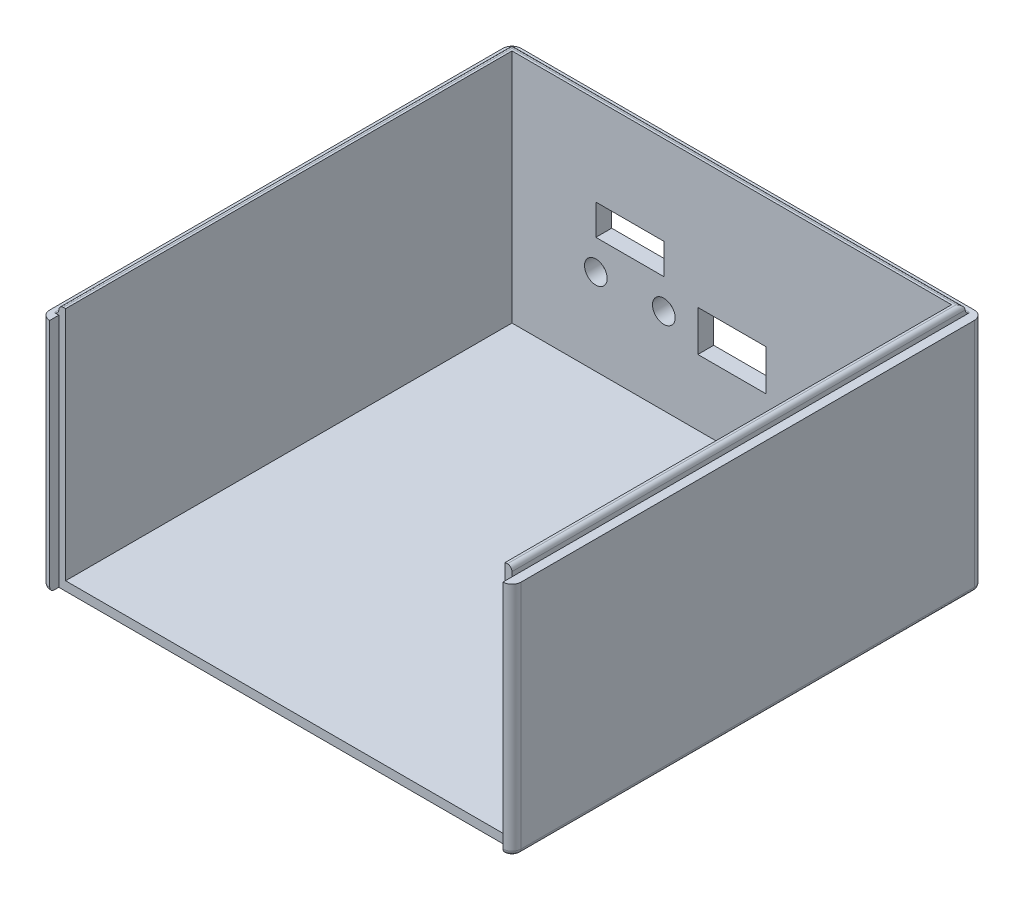
from build123d import *

# Parameters (mm, degrees)
SCHIZZO1_W                   = 100
SCHIZZO1_H                   = 100
ESTRUSIONE_ESTRUSIONE1_DEPTH = 2
ESTRUSIONE_ESTRUSIONE2_DEPTH = 52
ESTRUSIONE_ESTRUSIONE3_DEPTH = 54
RACCORDO1_R                  = 1
RACCORDO2_R                  = 1
RACCORDO3_R                  = 2
RACCORDO4_R                  = 2
RACCORDO5_R                  = 1
SCHIZZO4_R                   = 2.5
SCHIZZO4_W                   = 15.002685422
SCHIZZO4_H                   = 6.74925895
SCHIZZO4_W_2                 = 15
SCHIZZO4_H_2                 = 9
TAGLIO_ESTRUSIONE1_DEPTH     = 10


with BuildPart() as part:
    # Schizzo1 → Estrusione-Estrusione1 (new body)
    with BuildSketch(Plane(origin=(0, 0, 0), x_dir=(1, 0, 0), z_dir=(0, 1, 0))):
        Rectangle(SCHIZZO1_W, SCHIZZO1_H)
    extrude(amount=ESTRUSIONE_ESTRUSIONE1_DEPTH)

    # Schizzo2 → Estrusione-Estrusione2 (add)
    with BuildSketch(Plane(origin=(0, 0, 0), x_dir=(1, 0, 0), z_dir=(0, 1, 0))):
        Polygon((-50, -50), (-50, -52), (-52, -52), (-52, 52), (52, 52), (52, -52), (49.997213979, -52), (49.997213979, -50), (50, 50), (-50, 50), align=None)
    extrude(amount=ESTRUSIONE_ESTRUSIONE2_DEPTH)

    # Schizzo3 → Estrusione-Estrusione3 (add)
    with BuildSketch(Plane(origin=(0, 0, 0), x_dir=(1, 0, 0), z_dir=(0, 1, 0))):
        Polygon((-50, -50), (-50, 50), (50, 50), (49.997213979, -50), (48.497213979, -50), (48.497213979, 48.5), (-48.502786021, 48.5), (-48.502786021, -50), align=None)
    extrude(amount=ESTRUSIONE_ESTRUSIONE3_DEPTH)

    # Raccordo1
    raccordo1_edges = [part.edges().sort_by_distance(p)[0] for p in [
        (49.998606989, 54, 0),
        (0, 54, -50),
        (-50, 54, 0),
    ]]
    fillet(raccordo1_edges, radius=RACCORDO1_R)

    # Raccordo2
    raccordo2_edges = [part.edges().sort_by_distance(p)[0] for p in [
        (-50, 52, 0),
        (0, 52, -50),
    ]]
    fillet(raccordo2_edges, radius=RACCORDO2_R - 0.0001)  # a hair under: the kernel refuses the full size

    # Raccordo3
    raccordo3_edges = [part.edges().sort_by_distance(p)[0] for p in [
        (52, 26, 52),
        (52, 26, -52),
        (-52, 26, 52),
    ]]
    fillet(raccordo3_edges, radius=RACCORDO3_R - 0.0001)  # a hair under: the kernel refuses the full size

    # Raccordo4
    raccordo4_edges = [part.edges().sort_by_distance(p)[0] for p in [
        (-52, 26, -52),
    ]]
    fillet(raccordo4_edges, radius=RACCORDO4_R)

    # Raccordo5
    raccordo5_edges = [part.edges().sort_by_distance(p)[0] for p in [
        (5e-05, 0, -52),
        (52, 0, 0),
        (-51.414242852, 0, 51.414242852),
        (51.414242852, 0, 51.414242852),
        (51.414242852, 0, -51.414242852),
        (-52, 0, 5e-05),
        (-51.414213562, 0, -51.414213562),
        (49.998656989, 0, 52),
    ]]
    fillet(raccordo5_edges, radius=RACCORDO5_R)

    # Schizzo4 → Taglio-Estrusione1 (cut)
    with BuildSketch(Plane(origin=(0, 0, -52), x_dir=(-1, 0, 0), z_dir=(0, 0, -1))):
        with Locations((15, 21)):
            Circle(SCHIZZO4_R)
        with Locations((30.001342711, 21)):
            Circle(SCHIZZO4_R)
        with Locations((22.501342711, 31)):
            Rectangle(SCHIZZO4_W, SCHIZZO4_H)
        with Locations((-0.00336937, 21)):
            Rectangle(SCHIZZO4_W_2, SCHIZZO4_H_2)
    extrude(amount=-TAGLIO_ESTRUSIONE1_DEPTH, mode=Mode.SUBTRACT)


solid = part.part
